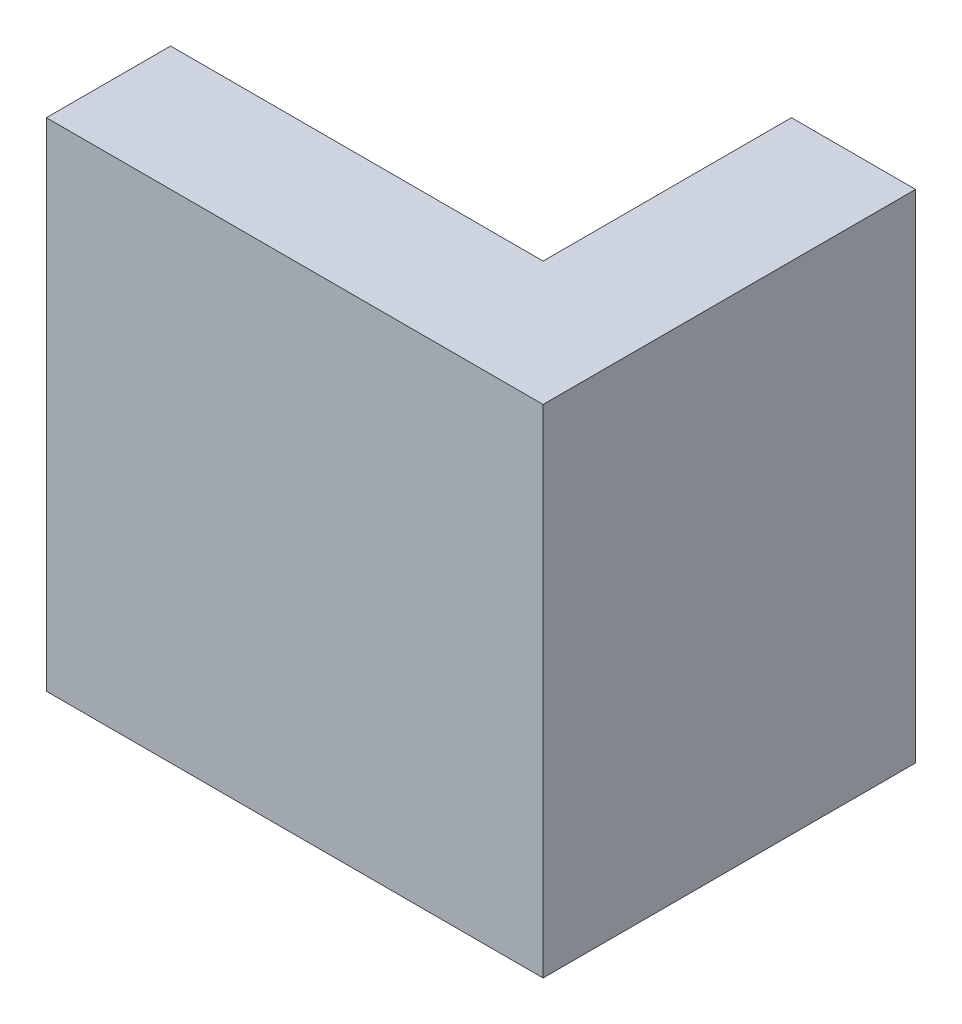
from build123d import *

# Parameters (mm, degrees)
SKETCH1_W           = 12.7
SKETCH1_H           = 3.175
BOSS_EXTRUDE1_DEPTH = 12.7
SKETCH2_W           = 3.175
SKETCH2_H           = 12.7
BOSS_EXTRUDE2_DEPTH = 6.35


with BuildPart() as part:
    # Sketch1 → Boss-Extrude1 (new body)
    with BuildSketch(Plane(origin=(0, 0, 0), x_dir=(1, 0, 0), z_dir=(0, 1, 0))):
        with Locations((6.35, 1.5875)):
            Rectangle(SKETCH1_W, SKETCH1_H)
    extrude(amount=BOSS_EXTRUDE1_DEPTH)

    # Sketch2 → Boss-Extrude2 (add)
    with BuildSketch(Plane(origin=(0, 0, -3.175), x_dir=(-1, 0, 0), z_dir=(0, 0, -1))):
        with Locations((-11.1125, 6.35)):
            Rectangle(SKETCH2_W, SKETCH2_H)
    extrude(amount=BOSS_EXTRUDE2_DEPTH)


solid = part.part
